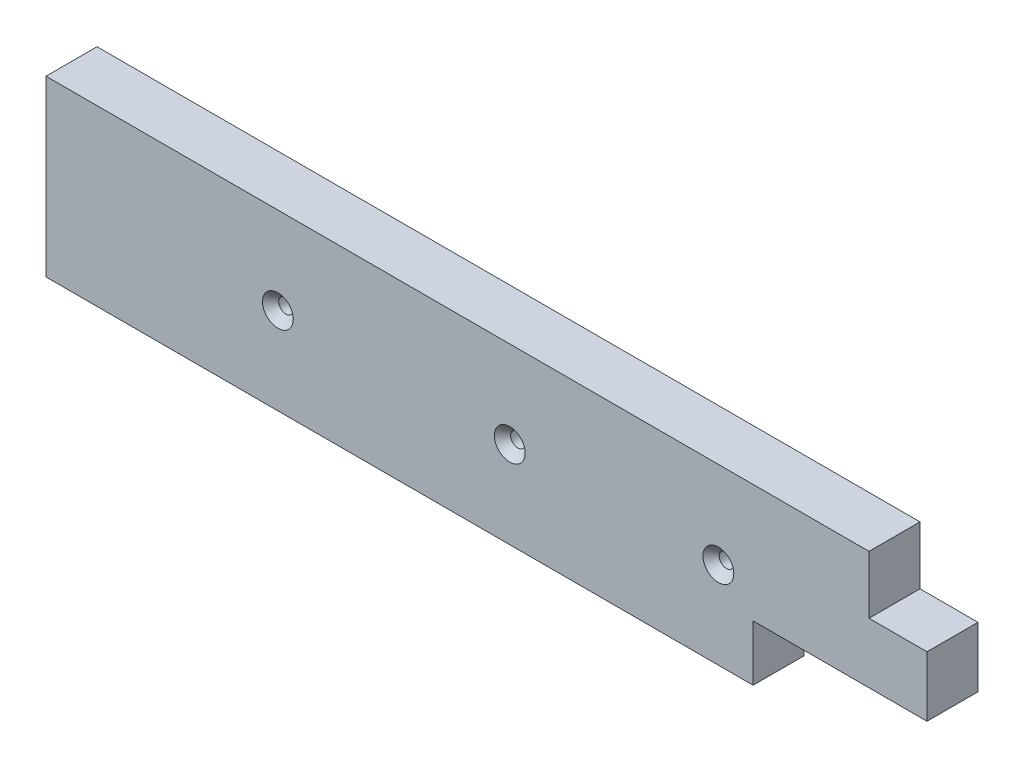
from build123d import *

# Parameters (mm, degrees)
SKETCH1_W                                            = 386.012712352
SKETCH1_H                                            = 22.352
BOSS_EXTRUDE1_DEPTH                                  = 38.1
CSK_FOR_M6_HEX_SOCKET_COUNTERSUNK_HEAD_S_D           = 6.4
CSK_FOR_M6_HEX_SOCKET_COUNTERSUNK_HEAD_S_CSINK_D     = 13.5
CSK_FOR_M6_HEX_SOCKET_COUNTERSUNK_HEAD_S_CSINK_ANGLE = 90
CSK_FOR_M6_HEX_SOCKET_COUNTERSUNK_HE_2_D             = 6.4
CSK_FOR_M6_HEX_SOCKET_COUNTERSUNK_HE_2_CSINK_D       = 13.5
CSK_FOR_M6_HEX_SOCKET_COUNTERSUNK_HE_2_CSINK_ANGLE   = 90
CSK_FOR_M6_HEX_SOCKET_COUNTERSUNK_HE_3_D             = 6.4
CSK_FOR_M6_HEX_SOCKET_COUNTERSUNK_HE_3_CSINK_D       = 13.5
CSK_FOR_M6_HEX_SOCKET_COUNTERSUNK_HE_3_CSINK_ANGLE   = 90
SKETCH3_W                                            = 25.4
SKETCH3_H                                            = 25.4
SKETCH3_W_2                                          = 76.186487456
SKETCH3_H_2                                          = 24.414636835
CUT_EXTRUDE1_DEPTH                                   = 198.996655094


with BuildPart() as part:
    # Sketch1 → Boss-Extrude1 (new, symmetric)
    with BuildSketch(Plane(origin=(0, 0, 0), x_dir=(1, 0, 0), z_dir=(0, 1, 0))):
        Rectangle(SKETCH1_W, SKETCH1_H)
    extrude(amount=BOSS_EXTRUDE1_DEPTH, both=True)

    # CSK for M6 Hex Socket Countersunk Head S (through all)
    with Locations(Plane.XY.offset(11.176)):
        with Locations((-91.406356176, 0)):
            CounterSinkHole(CSK_FOR_M6_HEX_SOCKET_COUNTERSUNK_HEAD_S_D / 2, CSK_FOR_M6_HEX_SOCKET_COUNTERSUNK_HEAD_S_CSINK_D / 2, counter_sink_angle=CSK_FOR_M6_HEX_SOCKET_COUNTERSUNK_HEAD_S_CSINK_ANGLE)

    # CSK for M6 Hex Socket Countersunk He 2 (through all)
    with Locations(Plane.XY.offset(11.176)):
        with Locations((10.193643824, 0)):
            CounterSinkHole(CSK_FOR_M6_HEX_SOCKET_COUNTERSUNK_HE_2_D / 2, CSK_FOR_M6_HEX_SOCKET_COUNTERSUNK_HE_2_CSINK_D / 2, counter_sink_angle=CSK_FOR_M6_HEX_SOCKET_COUNTERSUNK_HE_2_CSINK_ANGLE)

    # CSK for M6 Hex Socket Countersunk He 3 (through all)
    with Locations(Plane.XY.offset(11.176)):
        with Locations((101.6, 0)):
            CounterSinkHole(CSK_FOR_M6_HEX_SOCKET_COUNTERSUNK_HE_3_D / 2, CSK_FOR_M6_HEX_SOCKET_COUNTERSUNK_HE_3_CSINK_D / 2, counter_sink_angle=CSK_FOR_M6_HEX_SOCKET_COUNTERSUNK_HE_3_CSINK_ANGLE)

    # Sketch3 → Cut-Extrude1 (cut, through all)
    with BuildSketch(Plane.XY.offset(11.176)):
        with Locations((180.306356176, 25.4)):
            Rectangle(SKETCH3_W, SKETCH3_H)
        with Locations((154.913112448, -25.892681582)):
            Rectangle(SKETCH3_W_2, SKETCH3_H_2)
    extrude(amount=-CUT_EXTRUDE1_DEPTH, mode=Mode.SUBTRACT)


solid = part.part
